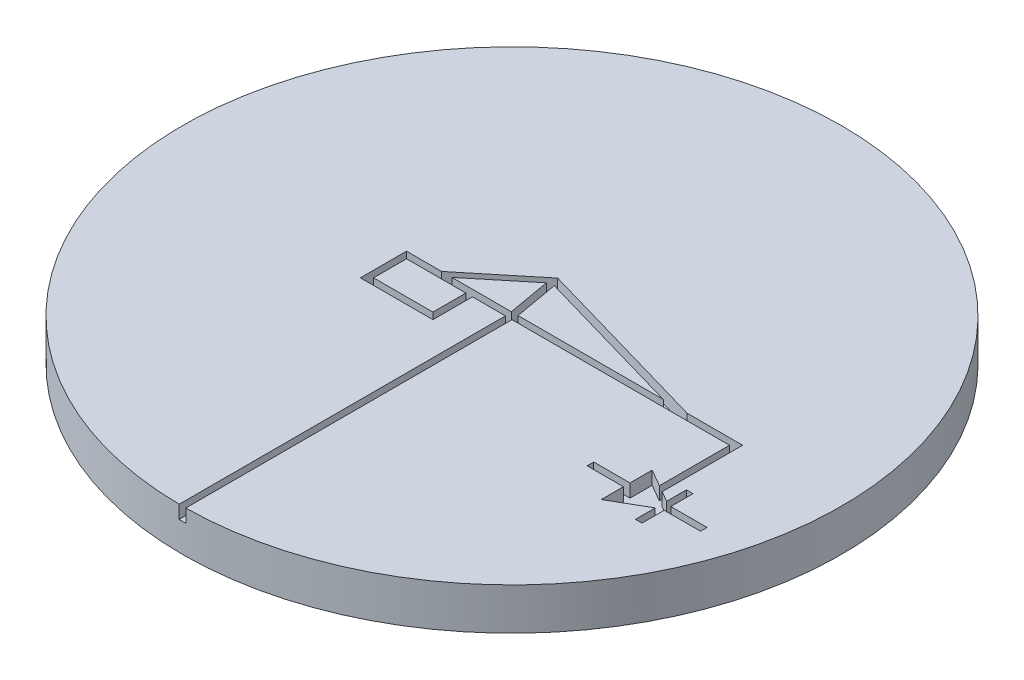
from build123d import *

# Parameters (mm, degrees)
SKETCH1_R           = 25
BOSS_EXTRUDE1_DEPTH = 3.175
CUT_EXTRUDE1_START  = -1
SKETCH2_W           = 4.5
SKETCH2_H           = 2.5
CUT_EXTRUDE1_DEPTH  = 1


with BuildPart() as part:
    # Sketch1 → Boss-Extrude1 (new body)
    with BuildSketch(Plane(origin=(0, 0, 0), x_dir=(1, 0, 0), z_dir=(0, 1, 0))):
        Circle(SKETCH1_R)
    extrude(amount=BOSS_EXTRUDE1_DEPTH)

    # Sketch2 → Cut-Extrude1 (cut)
    with BuildSketch(Plane(origin=(0, 3.175, 0), x_dir=(1, 0, 0), z_dir=(0, 1, 0)).offset(CUT_EXTRUDE1_START)):
        with BuildLine():
            Line((17.25, 0.25), (17.25, -5.855662433))
            Line((17.25, -5.855662433), (18.049038106, -6.316987298))
            Line((18.049038106, -6.316987298), (18.049038106, -5.25))
            Line((18.049038106, -5.25), (18.049038106, -4.816987298))
            Line((18.049038106, -4.816987298), (18.549038106, -4.816987298))
            Line((18.549038106, -4.816987298), (18.549038106, -5.25))
            Line((18.549038106, -5.25), (18.549038106, -6.5))
            Line((18.549038106, -6.5), (21.299038106, -6.5))
            Line((21.299038106, -6.5), (21.299038106, -7))
            Line((21.299038106, -7), (18.549038106, -7))
            Line((18.549038106, -7), (18.549038106, -8.25))
            Line((18.549038106, -8.25), (18.549038106, -8.683012702))
            Line((18.549038106, -8.683012702), (18.049038106, -8.683012702))
            Line((18.049038106, -8.683012702), (18.049038106, -8.25))
            Line((18.049038106, -8.25), (18.049038106, -7.183012702))
            Line((18.049038106, -7.183012702), (15.450961894, -8.683012702))
            Line((15.450961894, -8.683012702), (15.450961894, -7))
            Line((15.450961894, -7), (12.700961894, -7))
            Line((12.700961894, -7), (12.700961894, -6.5))
            Line((12.700961894, -6.5), (15.450961894, -6.5))
            Line((15.450961894, -6.5), (15.450961894, -4.816987298))
            Line((15.450961894, -4.816987298), (16.75, -5.566987298))
            Line((16.75, -5.566987298), (16.75, -0.25))
            Line((16.75, -0.25), (0.25, -0.25))
            Line((0.25, -0.25), (0.25, -24.998749969))
            ThreePointArc((0.25, -24.998749969), (0, -25), (-0.25, -24.998749969))
            Line((-0.25, -24.998749969), (-0.25, -0.25))
            Line((-0.25, -0.25), (-2.75, -0.25))
            Line((-2.75, -0.25), (-2.75, -3.25))
            Line((-2.75, -3.25), (-8.25, -3.25))
            Line((-8.25, -3.25), (-8.25, 0.25))
            Line((-8.25, 0.25), (-5.589373118, 0.25))
            Line((-5.589373118, 0.25), (-0.853083665, 4.132571689))
            Line((-0.853083665, 4.132571689), (-0.751596944, 4.215765395))
            Line((-0.751596944, 4.215765395), (-0.625482869, 4.179488852))
            Line((-0.625482869, 4.179488852), (13.035241579, 0.25))
            Line((13.035241579, 0.25), (17.25, 0.25))
        make_face()
        Polygon((-4.800684576, 0.25), (-0.297938398, 0.25), (-0.866588339, 3.47497407), align=None, mode=Mode.SUBTRACT)
        Polygon((0.209774908, 0.25), (-0.378852437, 3.588271558), (11.226526686, 0.25), align=None, mode=Mode.SUBTRACT)
        with Locations((-5.5, -1.5)):
            Rectangle(SKETCH2_W, SKETCH2_H, mode=Mode.SUBTRACT)
    extrude(amount=CUT_EXTRUDE1_DEPTH, mode=Mode.SUBTRACT)


solid = part.part
